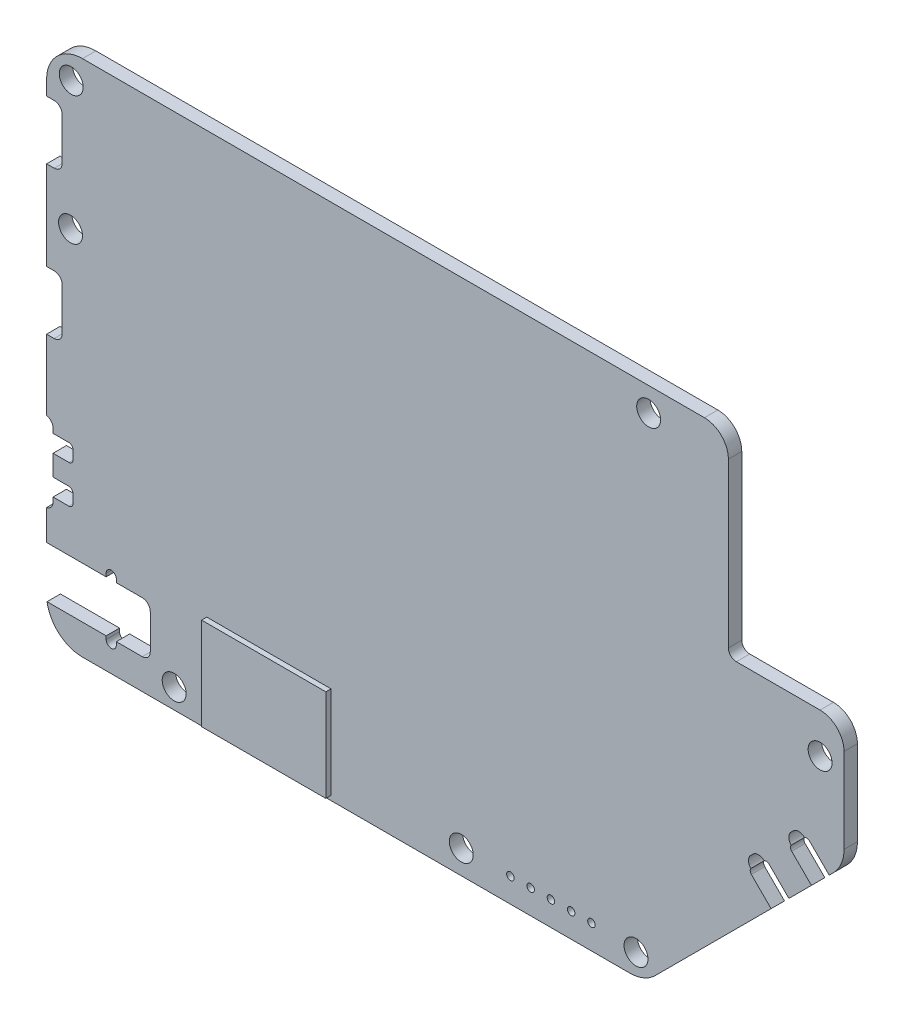
from build123d import *

# Parameters (mm, degrees)
BOARD_DEPTH                                   = 1.68
SKETCH2_R                                     = 1.5
SKETCH2_R_2                                   = 0.4699
PLATED_HOLES_DEPTH                            = 120.280435948
SKETCH85_W                                    = 15.24
SKETCH85_H                                    = 8.52231
T4_1_KK81_1_DEPTH                             = 0.65
SKETCH327_W                                   = 15.5762
SKETCH327_H                                   = 11.58
SPEAKER_SMT_WATERPROOF_2403_260_00107_1_DEPTH = 0.65
CUT_EXTRUDE1_DEPTH                            = 120.29136138
CUT_EXTRUDE1_DEPTH_BACK                       = 120.29136138
FILLET1_DEPTH                                 = 1.68
BOSS_EXTRUDE1_DEPTH                           = 1.68
CUT_EXTRUDE5_START                            = -1
CUT_EXTRUDE5_DEPTH                            = 4
CUT_EXTRUDE5_2_DEPTH                          = 1.68


with BuildPart() as part:
    # Sketch1 → BOARD (new body)
    with BuildSketch(Plane.XY):
        with BuildLine():
            Line((4.5, 0), (73.136038969, 0))
            ThreePointArc((73.136038969, 0), (74.858114415, 0.342542104), (76.318019485, 1.318019485))
            Line((76.318019485, 1.318019485), (98.681980515, 23.681980515))
            ThreePointArc((98.681980515, 23.681980515), (99.657457896, 25.141885585), (100, 26.863961031))
            Line((100, 26.863961031), (100, 60.5))
            ThreePointArc((100, 60.5), (98.681980515, 63.681980515), (95.5, 65))
            Line((95.5, 65), (4.5, 65))
            ThreePointArc((4.5, 65), (1.318019485, 63.681980515), (0, 60.5))
            Line((0, 60.5), (0, 58.675))
            Line((0, 58.675), (0.95, 58.675))
            ThreePointArc((0.95, 58.675), (1.657106781, 58.382106781), (1.95, 57.675))
            Line((1.95, 57.675), (1.95, 52.325))
            ThreePointArc((1.95, 52.325), (1.657106781, 51.617893219), (0.95, 51.325))
            Line((0.95, 51.325), (0, 51.325))
            Line((0, 51.325), (0, 40.175))
            Line((0, 40.175), (0.95, 40.175))
            ThreePointArc((0.95, 40.175), (1.657106781, 39.882106781), (1.95, 39.175))
            Line((1.95, 39.175), (1.95, 33.825))
            ThreePointArc((1.95, 33.825), (1.657106781, 33.117893219), (0.95, 32.825))
            Line((0.95, 32.825), (0, 32.825))
            Line((0, 32.825), (0, 24))
            Line((0, 24), (0.81, 24))
            Line((0.81, 24), (0.81, 22.455))
            Line((0.81, 22.455), (3.3, 22.455))
            Line((3.3, 22.455), (3.3, 20.295))
            Line((3.3, 20.295), (0.81, 20.295))
            Line((0.81, 20.295), (0.81, 17.705))
            Line((0.81, 17.705), (3.3, 17.705))
            Line((3.3, 17.705), (3.3, 15.545))
            Line((3.3, 15.545), (0.81, 15.545))
            Line((0.81, 15.545), (0.81, 14))
            Line((0.81, 14), (0, 14))
            Line((0, 14), (0, 10.2))
            Line((0, 10.2), (7.47, 10.2))
            Line((7.47, 10.2), (7.47, 10.61))
            ThreePointArc((7.47, 10.61), (8.105, 11.245), (8.74, 10.61))
            Line((8.74, 10.61), (8.74, 10.2))
            Line((8.74, 10.2), (12, 10.2))
            ThreePointArc((12, 10.2), (12.707106781, 9.907106781), (13, 9.2))
            Line((13, 9.2), (13, 4.8))
            ThreePointArc((13, 4.8), (12.707106781, 4.092893219), (12, 3.8))
            Line((12, 3.8), (8.74, 3.8))
            Line((8.74, 3.8), (8.74, 3.39))
            ThreePointArc((8.74, 3.39), (8.105, 2.755), (7.47, 3.39))
            Line((7.47, 3.39), (7.47, 3.8))
            Line((7.47, 3.8), (0.054777846, 3.8))
            ThreePointArc((0.054777846, 3.8), (1.575961697, 1.079473725), (4.5, 0))
        make_face()
    extrude(amount=BOARD_DEPTH)

    # Sketch2 → PLATED HOLES (cut, through all)
    with BuildSketch(Plane.XY):
        with Locations((97, 35.5)):
            Circle(SKETCH2_R)
        with Locations((65.786, 3.048)):
            Circle(SKETCH2_R_2)
        with Locations((60.706, 3.048)):
            Circle(SKETCH2_R_2)
        with Locations((58.166, 3.048)):
            Circle(SKETCH2_R_2)
        with Locations((63.246, 3.048)):
            Circle(SKETCH2_R_2)
        with Locations((52, 3)):
            Circle(SKETCH2_R)
        with Locations((68.326, 3.048)):
            Circle(SKETCH2_R_2)
        with Locations((16, 2.5)):
            Circle(SKETCH2_R)
        with Locations((73.917501226, 2.658990293)):
            Circle(SKETCH2_R)
        with Locations((3, 45.75)):
            Circle(SKETCH2_R)
        with Locations((3.085786438, 61.914213562)):
            Circle(SKETCH2_R)
        with Locations((75.5, 62)):
            Circle(SKETCH2_R)
    extrude(amount=PLATED_HOLES_DEPTH, mode=Mode.SUBTRACT)

    # Sketch370 → Cut-Extrude1 (cut, two sides: drawn at the far end of the back side and taken through both)
    with BuildSketch(Plane.XY.offset(1.68).offset(-CUT_EXTRUDE1_DEPTH_BACK)):
        with BuildLine():
            ThreePointArc((82.5, 65), (84.621320344, 64.121320344), (85.5, 62))
            Line((85.5, 62), (85.5, 41.5))
            ThreePointArc((85.5, 41.5), (85.792893219, 40.792893219), (86.5, 40.5))
            Line((86.5, 40.5), (97, 40.5))
            ThreePointArc((97, 40.5), (99.121320344, 39.621320344), (100, 37.5))
            Line((100, 37.5), (100, 60.5))
            ThreePointArc((100, 60.5), (98.681980515, 63.681980515), (95.5, 65))
            Line((95.5, 65), (82.5, 65))
        make_face()
    extrude(amount=CUT_EXTRUDE1_DEPTH + CUT_EXTRUDE1_DEPTH_BACK, mode=Mode.SUBTRACT)

    # Fillet1: read off the stored shape, not the designer's step
    # Fillet1 outline → Fillet1 (cut)
    with BuildSketch(Plane.XY):
        with BuildLine():
            ThreePointArc((90.610912703, 20.560660172), (90.257359313, 20.707106781), (89.903805922, 20.560660172))
            Line((89.903805922, 20.560660172), (88.383526343, 19.040380592))
            ThreePointArc((88.383526343, 19.040380592), (88.237079733, 18.686827202), (88.383526343, 18.333273811))
            Line((88.383526343, 18.333273811), (90.858400077, 15.858400077))
            Line((90.858400077, 15.858400077), (93.085786438, 18.085786438))
            Line((93.085786438, 18.085786438), (90.610912703, 20.560660172))
        make_face()
        with BuildLine():
            Line((93.439339828, 23.389087297), (95.914213562, 20.914213562))
            Line((95.914213562, 20.914213562), (98.141599923, 23.141599923))
            Line((98.141599923, 23.141599923), (95.666726189, 25.616473657))
            ThreePointArc((95.666726189, 25.616473657), (95.313172799, 25.762920267), (94.959619408, 25.616473657))
            Line((94.959619408, 25.616473657), (93.439339828, 24.096194078))
            ThreePointArc((93.439339828, 24.096194078), (93.292893219, 23.742640687), (93.439339828, 23.389087297))
        make_face()
    extrude(amount=FILLET1_DEPTH, mode=Mode.SUBTRACT)

    # Sketch373 → Boss-Extrude1 (add)
    with BuildSketch(Plane.XY.offset(1.68)):
        with BuildLine():
            Line((0, 24), (0.81, 24))
            Line((0.81, 24), (0.81, 23.01821591))
            ThreePointArc((0.81, 23.01821591), (0.581362431, 23.654612013), (0, 24))
        make_face()
        with BuildLine():
            Line((0.81, 14.98178409), (0.81, 14))
            Line((0.81, 14), (0, 14))
            ThreePointArc((0, 14), (0.581362431, 14.345387987), (0.81, 14.98178409))
        make_face()
    extrude(amount=-BOSS_EXTRUDE1_DEPTH)

    # Cut-Extrude5: read off the stored shape, not the designer's step
    # Cut-Extrude5 outline → Cut-Extrude5 (cut)
    with BuildSketch(Plane.XY.offset(CUT_EXTRUDE5_START)):
        with BuildLine():
            Line((88.560303038, 20.63137085), (88.312815665, 20.383883476))
            ThreePointArc((88.312815665, 20.383883476), (88.019922446, 19.676776695), (88.312815665, 18.969669914))
            Line((88.312815665, 18.969669914), (88.319958894, 18.962526685))
            ThreePointArc((88.319958894, 18.962526685), (88.349781399, 19.003054968), (88.383526343, 19.040380592))
            Line((88.383526343, 19.040380592), (89.903805922, 20.560660172))
            ThreePointArc((89.903805922, 20.560660172), (89.941131547, 20.594405116), (89.981659829, 20.624227621))
            Line((89.981659829, 20.624227621), (89.9745166, 20.63137085))
            ThreePointArc((89.9745166, 20.63137085), (89.267409819, 20.924264069), (88.560303038, 20.63137085))
        make_face()
        with BuildLine():
            ThreePointArc((95.030330086, 25.687184335), (94.323223305, 25.980077554), (93.616116524, 25.687184335))
            Line((93.616116524, 25.687184335), (93.36862915, 25.439696962))
            ThreePointArc((93.36862915, 25.439696962), (93.075735931, 24.732590181), (93.36862915, 24.0254834))
            Line((93.36862915, 24.0254834), (93.375772379, 24.018340171))
            ThreePointArc((93.375772379, 24.018340171), (93.405594884, 24.058868453), (93.439339828, 24.096194078))
            Line((93.439339828, 24.096194078), (94.959619408, 25.616473657))
            ThreePointArc((94.959619408, 25.616473657), (94.996945032, 25.650218601), (95.037473315, 25.680041106))
            Line((95.037473315, 25.680041106), (95.030330086, 25.687184335))
        make_face()
    extrude(amount=CUT_EXTRUDE5_DEPTH, mode=Mode.SUBTRACT)

    # Cut-Extrude5 2 outline → Cut-Extrude5 2 (add)
    with BuildSketch(Plane.XY):
        with BuildLine():
            ThreePointArc((2.8, 17.705), (3.153553391, 17.558553391), (3.3, 17.205))
            Line((3.3, 17.205), (3.3, 17.705))
            Line((3.3, 17.705), (2.8, 17.705))
        make_face()
        with BuildLine():
            ThreePointArc((3.3, 16.045), (3.153553391, 15.691446609), (2.8, 15.545))
            Line((2.8, 15.545), (3.3, 15.545))
            Line((3.3, 15.545), (3.3, 16.045))
        make_face()
        with BuildLine():
            ThreePointArc((2.8, 22.455), (3.153553391, 22.308553391), (3.3, 21.955))
            Line((3.3, 21.955), (3.3, 22.455))
            Line((3.3, 22.455), (2.8, 22.455))
        make_face()
        with BuildLine():
            ThreePointArc((3.3, 20.795), (3.153553391, 20.441446609), (2.8, 20.295))
            Line((2.8, 20.295), (3.3, 20.295))
            Line((3.3, 20.295), (3.3, 20.795))
        make_face()
    extrude(amount=CUT_EXTRUDE5_2_DEPTH)


with BuildPart() as body_2:
    # Sketch85 → T4-1-KK81-1 (new body)
    with BuildSketch(Plane.XY):
        with Locations((9, 28.148845)):
            Rectangle(SKETCH85_W, SKETCH85_H)
    extrude(amount=-T4_1_KK81_1_DEPTH)


with BuildPart() as body_3:
    # Sketch327 → SPEAKER_SMT_WATERPROOF_2403-260-00107-1 (new body)
    with BuildSketch(Plane.XY.offset(1.68)):
        with Locations((27.8805, 6.35)):
            Rectangle(SKETCH327_W, SKETCH327_H)
    extrude(amount=SPEAKER_SMT_WATERPROOF_2403_260_00107_1_DEPTH)


solid = Compound([part.part, body_2.part, body_3.part])
